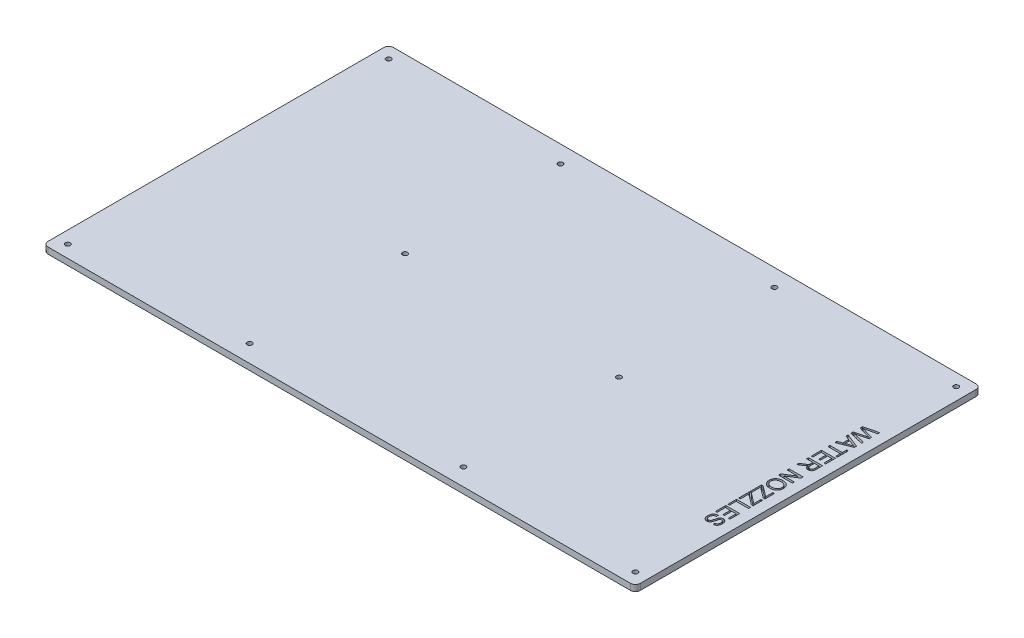
from build123d import *

# Parameters (mm, degrees)
SKETCH1_W           = 304.8
SKETCH1_H           = 177.8
SKETCH1_R           = 1.27
BOSS_EXTRUDE1_DEPTH = 3.175
CUT_EXTRUDE1_DEPTH  = 2.54
FILLET1_R           = 2.54


with BuildPart() as part:
    # Sketch1 → Boss-Extrude1 (new body)
    with BuildSketch(Plane(origin=(0, 0, 0), x_dir=(1, 0, 0), z_dir=(0, 1, 0))):
        Rectangle(SKETCH1_W, SKETCH1_H)
        with Locations((-55.0291, 80.01)):
            Circle(SKETCH1_R, mode=Mode.SUBTRACT)
        with Locations((-55.033333333, 0)):
            Circle(SKETCH1_R, mode=Mode.SUBTRACT)
        with Locations((-55.0291, -80.01)):
            Circle(SKETCH1_R, mode=Mode.SUBTRACT)
        with Locations((55.0291, -80.01)):
            Circle(SKETCH1_R, mode=Mode.SUBTRACT)
        with Locations((55.033333333, 0)):
            Circle(SKETCH1_R, mode=Mode.SUBTRACT)
        with Locations((55.0291, 80.01)):
            Circle(SKETCH1_R, mode=Mode.SUBTRACT)
        with Locations((-146.05, 82.55)):
            Circle(SKETCH1_R, mode=Mode.SUBTRACT)
        with Locations((-146.05, -82.55)):
            Circle(SKETCH1_R, mode=Mode.SUBTRACT)
        with Locations((146.05, -82.55)):
            Circle(SKETCH1_R, mode=Mode.SUBTRACT)
        with Locations((146.05, 82.55)):
            Circle(SKETCH1_R, mode=Mode.SUBTRACT)
    extrude(amount=BOSS_EXTRUDE1_DEPTH)

    # Sketch2 → Cut-Extrude1 (cut)
    # profile 1 of 12: a face of its own
    with BuildSketch(Plane(origin=(0, 3.175, 0), x_dir=(1, 0, 0), z_dir=(0, 1, 0))):
        with BuildLine():
            Line((139.7, 40.599397314), (146.891292318, 42.410185463))
            Line((146.891292318, 42.410185463), (146.891292318, 41.362895897))
            Line((146.891292318, 41.362895897), (142.161922791, 40.295438444))
            add(Edge.make_bspline(
                [(142.161922791, 40.295438444), (141.918010101, 40.240116159), (141.43267487, 40.130036385), (140.947069932, 40.021152573), (140.705513229, 39.966989996)],
                knots=[0, 0, 0, 0, 1.00513078, 2, 2, 2, 2], degree=3))
            add(Edge.make_bspline(
                [(140.705513229, 39.966989996), (140.792371041, 39.941345716), (140.956342762, 39.892933987), (141.188788479, 39.827490711), (141.391660637, 39.768050681), (141.565904996, 39.717410826), (141.711766359, 39.676407931), (141.82745239, 39.641006497), (141.915228597, 39.616877322), (141.963619911, 39.602578329), (141.983292933, 39.596765212)],
                knots=[0, 0, 0, 0, 1.633809233, 3.084334118, 4.356383392, 5.447555203, 6.357852567, 7.089694452, 7.629924063, 8, 8, 8, 8], degree=3))
            Line((141.983292933, 39.596765212), (146.891292318, 38.176369734))
            Line((146.891292318, 38.176369734), (146.891292318, 36.956212564))
            Line((146.891292318, 36.956212564), (143.288443342, 35.929090885))
            add(Edge.make_bspline(
                [(143.288443342, 35.929090885), (143.065873463, 35.872408071), (142.627013829, 35.760641828), (141.973316149, 35.612142336), (141.335477306, 35.475082051), (140.913616359, 35.396132754), (140.705513229, 35.357187229)],
                knots=[0, 0, 0, 0, 1.04154457, 2.053700482, 3.039894486, 4, 4, 4, 4], degree=3))
            add(Edge.make_bspline(
                [(140.705513229, 35.357187229), (140.812108286, 35.333148364), (141.036323517, 35.282584298), (141.390339814, 35.203396852), (141.778206423, 35.11544733), (142.048588999, 35.054626897), (142.189293495, 35.022976528)],
                knots=[0, 0, 0, 0, 0.862132589, 1.813435466, 2.862132822, 4, 4, 4, 4], degree=3))
            Line((142.189293495, 35.022976528), (146.891292318, 33.961281328))
            Line((146.891292318, 33.961281328), (146.891292318, 32.913991762))
            Line((146.891292318, 32.913991762), (139.7, 34.726220475))
            Line((139.7, 34.726220475), (139.7, 35.841216519))
            Line((139.7, 35.841216519), (145.195749237, 37.343724109))
            add(Edge.make_bspline(
                [(145.195749237, 37.343724109), (145.249475294, 37.35881145), (145.351534795, 37.387471778), (145.497177163, 37.425038757), (145.625263633, 37.462292796), (145.737449513, 37.491924711), (145.832604318, 37.517568652), (145.910449451, 37.540277459), (145.972508465, 37.554883152), (146.007780963, 37.565445312), (146.022632609, 37.569892557)],
                knots=[0, 0, 0, 0, 1.562239628, 2.967673567, 4.210417925, 5.296319877, 6.215971374, 6.969386481, 7.566055473, 8, 8, 8, 8], degree=3))
            add(Edge.make_bspline(
                [(146.022632609, 37.569892557), (145.928450634, 37.596558009), (145.750492988, 37.646942608), (145.499965869, 37.721559871), (145.2796766, 37.784171595), (145.143390879, 37.823850077), (145.080504168, 37.842159033)],
                knots=[0, 0, 0, 0, 1.197730334, 2.263121701, 3.198547257, 4, 4, 4, 4], degree=3))
            Line((145.080504168, 37.842159033), (139.7, 39.399408031))
            Line((139.7, 39.399408031), (139.7, 40.599397314))
        make_face()
    # profile 2 of 12: a face of its own
    with BuildSketch(Plane(origin=(0, 3.175, 0), x_dir=(1, 0, 0), z_dir=(0, 1, 0))):
        Polygon((139.7, 33.252524153), (146.891292318, 30.397327563), (146.891292318, 29.253520252), (139.7, 26.398323662), (139.7, 27.474424496), (141.912705329, 28.292664487), (141.912705329, 31.358183328), (139.7, 32.176423319), align=None)
        with BuildLine():
            Line((142.742469827, 31.052783894), (142.742469827, 28.598063921))
            Line((142.742469827, 28.598063921), (144.632488962, 29.296737152))
            add(Edge.make_bspline(
                [(144.632488962, 29.296737152), (144.705516725, 29.32352179), (144.848299792, 29.375890813), (145.055751534, 29.453988804), (145.252756224, 29.52533787), (145.436489095, 29.595301488), (145.609619053, 29.658458896), (145.770976683, 29.716672698), (145.919440472, 29.774245656), (146.015363377, 29.808795999), (146.06152782, 29.825423907)],
                knots=[0, 0, 0, 0, 1.225184869, 2.395467751, 3.491410812, 4.525364584, 5.492066482, 6.394148129, 7.227157926, 8, 8, 8, 8], degree=3))
            add(Edge.make_bspline(
                [(146.06152782, 29.825423907), (145.947690369, 29.852929678), (145.71954608, 29.908054634), (145.385284092, 30.02347287), (145.05407908, 30.155507323), (144.840652831, 30.262735032), (144.733328397, 30.316656015)],
                knots=[0, 0, 0, 0, 0.9891762, 1.982431084, 2.985436691, 4, 4, 4, 4], degree=3))
            Line((144.733328397, 30.316656015), (142.742469827, 31.052783894))
        make_face(mode=Mode.SUBTRACT)
    # profile 3 of 12: a face of its own
    with BuildSketch(Plane(origin=(0, 3.175, 0), x_dir=(1, 0, 0), z_dir=(0, 1, 0))):
        Polygon((139.7, 23.878778337), (146.06152782, 23.878778337), (146.06152782, 26.183679721), (146.891292318, 26.183679721), (146.891292318, 20.559720344), (146.06152782, 20.559720344), (146.06152782, 22.864621728), (139.7, 22.864621728), align=None)
    # profile 4 of 12: a face of its own
    with BuildSketch(Plane(origin=(0, 3.175, 0), x_dir=(1, 0, 0), z_dir=(0, 1, 0))):
        Polygon((139.7, 19.545563735), (146.891292318, 19.545563735), (146.891292318, 14.474780691), (146.06152782, 14.474780691), (146.06152782, 18.531407126), (143.848822491, 18.531407126), (143.848822491, 14.751368857), (143.019057993, 14.751368857), (143.019057993, 18.531407126), (140.529764498, 18.531407126), (140.529764498, 14.29038858), (139.7, 14.29038858), align=None)
    # profile 5 of 12: a face of its own
    with BuildSketch(Plane(origin=(0, 3.175, 0), x_dir=(1, 0, 0), z_dir=(0, 1, 0))):
        with BuildLine():
            Line((139.7, 12.90744775), (146.891292318, 12.90744775))
            Line((146.891292318, 12.90744775), (146.891292318, 9.787187501))
            add(Edge.make_bspline(
                [(146.891292318, 9.787187501), (146.890719358, 9.713714577), (146.88961046, 9.571516331), (146.881686545, 9.365305218), (146.864852182, 9.173282605), (146.846050259, 8.99423828), (146.818288848, 8.828478621), (146.785719716, 8.675924614), (146.747226755, 8.537161395), (146.70172659, 8.41113294), (146.65026646, 8.294196999), (146.586739284, 8.185835298), (146.517241888, 8.081403532), (146.434932223, 7.98503292), (146.346427046, 7.89250504), (146.247351056, 7.806981757), (146.139103449, 7.728045686), (145.984348252, 7.630645623), (145.777192572, 7.528158567), (145.513452672, 7.440686114), (145.236989629, 7.384760592), (145.048120631, 7.378739403), (144.952294029, 7.375684428)],
                knots=[0, 0, 0, 0, 1.242122331, 2.403982386, 3.487329914, 4.500326623, 5.446523787, 6.327028739, 7.136568587, 7.878666205, 8.590811102, 9.292609518, 9.999600102, 10.708452415, 11.431798422, 12.162621657, 12.917616336, 13.694634159, 15.252079616, 16.810286496, 18.381632726, 20, 20, 20, 20], degree=3))
            add(Edge.make_bspline(
                [(144.952294029, 7.375684428), (144.890778569, 7.37709165), (144.769281319, 7.379871008), (144.590647648, 7.401160869), (144.419971093, 7.439683966), (144.255753461, 7.48907958), (144.100333994, 7.556697048), (143.950491545, 7.63499364), (143.810516278, 7.732126935), (143.675747631, 7.84058847), (143.552200949, 7.966682451), (143.438215685, 8.107045246), (143.339735409, 8.265209511), (143.25123324, 8.438264749), (143.173787754, 8.626524977), (143.10867237, 8.83124209), (143.057693754, 9.051691208), (143.032157635, 9.204567236), (143.019057993, 9.282990324)],
                knots=[0, 0, 0, 0, 0.98268397, 1.940868231, 2.867803148, 3.77529712, 4.675825539, 5.571570676, 6.471608834, 7.392971743, 8.331421822, 9.286283743, 10.275919943, 11.301762849, 12.388744527, 13.524158817, 14.729930953, 16, 16, 16, 16], degree=3))
            add(Edge.make_bspline(
                [(143.019057993, 9.282990324), (142.989925812, 9.2250232), (142.934789019, 9.115312181), (142.846271077, 8.963984742), (142.758672467, 8.834036947), (142.694617331, 8.759083356), (142.664679405, 8.724051738)],
                knots=[0, 0, 0, 0, 1.172410807, 2.218954047, 3.167579294, 4, 4, 4, 4], degree=3))
            add(Edge.make_bspline(
                [(142.664679405, 8.724051738), (142.598176784, 8.65600296), (142.46179086, 8.516446123), (142.2273313, 8.326002591), (141.969492889, 8.137560987), (141.78160129, 8.024424583), (141.685096317, 7.966315408)],
                knots=[0, 0, 0, 0, 0.918170575, 1.883016652, 2.912673989, 4, 4, 4, 4], degree=3))
            Line((141.685096317, 7.966315408), (139.7, 6.786494012))
            Line((139.7, 6.786494012), (139.7, 7.949028648))
            Line((139.7, 7.949028648), (141.218353787, 8.845059061))
            add(Edge.make_bspline(
                [(141.218353787, 8.845059061), (141.271626158, 8.877277139), (141.374859267, 8.939710486), (141.525640959, 9.0298715), (141.664406238, 9.11835134), (141.795360764, 9.200146835), (141.915099613, 9.2796333), (142.027194869, 9.352347094), (142.127215347, 9.423882684), (142.247678565, 9.507079512), (142.378793463, 9.607385335), (142.51264314, 9.725227599), (142.621935013, 9.834572419), (142.727516561, 9.971377692), (142.8258971, 10.141134426), (142.871617982, 10.285131355), (142.89372898, 10.354769467)],
                knots=[0, 0, 0, 0, 1.130769053, 2.191244754, 3.190605808, 4.119719489, 4.995392299, 5.800890497, 6.546104885, 7.228445539, 8.4599972, 9.541354885, 10.466489475, 11.262010607, 12.675885558, 14, 14, 14, 14], degree=3))
            add(Edge.make_bspline(
                [(142.89372898, 10.354769467), (142.899000238, 10.383999999), (142.911034679, 10.450734181), (142.918894392, 10.564048654), (142.927236425, 10.701343041), (142.926993366, 10.800842622), (142.926861937, 10.854644955)],
                knots=[0, 0, 0, 0, 0.709978628, 1.620902492, 2.713552433, 4, 4, 4, 4], degree=3))
            Line((142.926861937, 10.854644955), (142.926861937, 11.893291141))
            Line((142.926861937, 11.893291141), (139.7, 11.893291141))
            Line((139.7, 11.893291141), (139.7, 12.90744775))
        make_face()
        with BuildLine():
            Line((143.756626436, 11.893291141), (143.756626436, 9.967257922))
            add(Edge.make_bspline(
                [(143.756626436, 9.967257922), (143.758143556, 9.870680588), (143.76097967, 9.690138321), (143.785027209, 9.437659887), (143.823660549, 9.222100977), (143.879107351, 9.039438161), (143.956434937, 8.886057448), (144.052511636, 8.754288984), (144.169411157, 8.642191056), (144.303830251, 8.550576168), (144.450495496, 8.478417995), (144.605647263, 8.429158458), (144.765929244, 8.394839629), (144.875280389, 8.391521992), (144.930685578, 8.389841037)],
                knots=[0, 0, 0, 0, 1.545806995, 2.889741191, 4.055176196, 5.047087691, 5.934047151, 6.79198357, 7.645535072, 8.5133672, 9.386595861, 10.252007348, 11.114340652, 12, 12, 12, 12], degree=3))
            add(Edge.make_bspline(
                [(144.930685578, 8.389841037), (144.971051349, 8.391179534), (145.050116036, 8.393801256), (145.166161046, 8.407545188), (145.276430627, 8.434266655), (145.381507679, 8.469552288), (145.480622586, 8.516701053), (145.574543379, 8.572711862), (145.662749512, 8.639550049), (145.745509673, 8.716109346), (145.820813333, 8.804013332), (145.885784057, 8.90442035), (145.940995157, 9.016538495), (145.984814377, 9.140498087), (146.01986262, 9.27590863), (146.043179085, 9.423540987), (146.060050802, 9.582720003), (146.061026282, 9.69302183), (146.06152782, 9.749732854)],
                knots=[0, 0, 0, 0, 0.965208469, 1.890559848, 2.786986821, 3.67262109, 4.535197034, 5.405224191, 6.282113641, 7.175449223, 8.095446547, 9.040936516, 10.026471658, 11.075712529, 12.17809725, 13.364958037, 14.645208957, 16, 16, 16, 16], degree=3))
            Line((146.06152782, 9.749732854), (146.06152782, 11.893291141))
            Line((146.06152782, 11.893291141), (143.756626436, 11.893291141))
        make_face(mode=Mode.SUBTRACT)
    # profile 6 of 12: a face of its own
    with BuildSketch(Plane(origin=(0, 3.175, 0), x_dir=(1, 0, 0), z_dir=(0, 1, 0))):
        Polygon((139.7, 2.950273771), (146.891292318, 2.950273771), (146.891292318, 1.878494628), (141.525193783, -1.567332941), (146.891292318, -1.567332941), (146.891292318, -2.58148955), (139.7, -2.58148955), (139.7, -1.509710406), (145.066098534, 1.936117162), (139.7, 1.936117162), align=None)
    # profile 7 of 12: a face of its own
    with BuildSketch(Plane(origin=(0, 3.175, 0), x_dir=(1, 0, 0), z_dir=(0, 1, 0))):
        with BuildLine():
            add(Edge.make_bspline(
                [(143.200568977, -3.872234325), (143.344742891, -3.874750601), (143.625658451, -3.879653438), (144.034795943, -3.92492341), (144.419281361, -3.999605887), (144.780893264, -4.102339363), (145.116904413, -4.238978276), (145.431446648, -4.401107285), (145.719045321, -4.597822571), (145.983025744, -4.820098076), (146.216382386, -5.068437708), (146.42364216, -5.332831608), (146.59651991, -5.61660193), (146.739260307, -5.917121453), (146.848852157, -6.235668389), (146.925576448, -6.57134797), (146.975071065, -6.923801293), (146.98064185, -7.164711385), (146.983488373, -7.287810063)],
                knots=[0, 0, 0, 0, 1.203593535, 2.345140965, 3.431924157, 4.471254512, 5.478692091, 6.45615896, 7.42038538, 8.382007041, 9.33218277, 10.260966195, 11.182476517, 12.100814648, 13.034113903, 13.98924309, 14.972556454, 16, 16, 16, 16], degree=3))
            add(Edge.make_bspline(
                [(146.983488373, -7.287810063), (146.982083246, -7.369004565), (146.979292919, -7.530242159), (146.957643942, -7.769046914), (146.920039242, -8.001421819), (146.86778006, -8.227532904), (146.801835233, -8.447603788), (146.721044891, -8.662083881), (146.623835099, -8.869598947), (146.513808435, -9.070695723), (146.389328101, -9.262238692), (146.254649039, -9.444049022), (146.106799681, -9.613148244), (145.947920566, -9.77054561), (145.777938945, -9.9165831), (145.594741796, -10.049441633), (145.401125111, -10.171807619), (145.195584993, -10.28104651), (144.982240572, -10.3788984), (144.760014789, -10.462484041), (144.531625728, -10.534270472), (144.295707331, -10.594358298), (144.052344136, -10.637473782), (143.802583707, -10.671806857), (143.545610036, -10.689877354), (143.372019731, -10.693107052), (143.284121652, -10.694742421)],
                knots=[0, 0, 0, 0, 1.034309052, 2.053950705, 3.051627699, 4.031038476, 5.008402854, 5.97643726, 6.948041091, 7.925482047, 8.894385902, 9.856059247, 10.805611944, 11.752954998, 12.703138077, 13.657545741, 14.63347317, 15.618750787, 16.620694897, 17.621667406, 18.641309059, 19.669521506, 20.720627516, 21.788266251, 22.880080611, 24, 24, 24, 24], degree=3))
            add(Edge.make_bspline(
                [(143.284121652, -10.694742421), (143.194774132, -10.693244066), (143.018252702, -10.690283806), (142.75747654, -10.670253479), (142.504186722, -10.635033201), (142.257627978, -10.588319503), (142.018313612, -10.525724559), (141.78555742, -10.451340137), (141.560746026, -10.361367792), (141.343336543, -10.259754686), (141.136322927, -10.144777048), (140.941138804, -10.017957762), (140.759660471, -9.879166874), (140.589476659, -9.7306586), (140.434565882, -9.56868993), (140.290383421, -9.3967376), (140.161526545, -9.211921943), (140.044348478, -9.017795627), (139.943626094, -8.815008266), (139.85320227, -8.608118694), (139.77713015, -8.396879802), (139.714892871, -8.181819365), (139.667370015, -7.96275636), (139.63270603, -7.740089103), (139.612261458, -7.512920576), (139.609297418, -7.360358764), (139.607803945, -7.283488373)],
                knots=[0, 0, 0, 0, 1.141388526, 2.255009839, 3.338557341, 4.406873761, 5.458773361, 6.496627797, 7.526383469, 8.5499449, 9.560445588, 10.548978906, 11.520676971, 12.476877461, 13.431305422, 14.380871584, 15.340724931, 16.306479833, 17.274880643, 18.230982746, 19.189541512, 20.140849708, 21.088988189, 22.051132196, 23.018035844, 24, 24, 24, 24], degree=3))
            add(Edge.make_bspline(
                [(139.607803945, -7.283488373), (139.609026868, -7.200837462), (139.611449174, -7.037126706), (139.635624736, -6.795157068), (139.672512416, -6.559210096), (139.725741713, -6.329958393), (139.795273652, -6.107764179), (139.878947671, -5.892589322), (139.977210681, -5.683912211), (140.091114191, -5.483159574), (140.216853762, -5.290518027), (140.356042488, -5.109892863), (140.505615144, -4.940767394), (140.667824314, -4.78521722), (140.839585734, -4.640794425), (141.022012391, -4.507224855), (141.216181233, -4.386540322), (141.421009429, -4.27937035), (141.631310907, -4.18273359), (141.84697264, -4.101270405), (142.064864534, -4.029692273), (142.286316752, -3.972684518), (142.51082187, -3.927257082), (142.738005404, -3.896710233), (142.968205951, -3.87464912), (143.122724858, -3.873043307), (143.200568977, -3.872234325)],
                knots=[0, 0, 0, 0, 1.072763531, 2.124875893, 3.153923666, 4.171672792, 5.177320289, 6.174136357, 7.166947757, 8.169130198, 9.168574722, 10.151174515, 11.127106349, 12.097106019, 13.066163601, 14.038804255, 15.030068075, 16.031241659, 17.038395341, 18.032966873, 19.022680693, 20.014630449, 21.000093848, 21.9946263, 22.989725266, 24, 24, 24, 24], degree=3))
        make_face()
        with BuildLine():
            add(Edge.make_bspline(
                [(143.18904447, -4.886390934), (143.085221971, -4.8879442), (142.882775424, -4.890972961), (142.587626766, -4.925655463), (142.309110467, -4.978218734), (142.04657521, -5.050883677), (141.801950955, -5.147900238), (141.574767951, -5.266514417), (141.363952405, -5.405651782), (141.171893417, -5.565239122), (140.999302669, -5.740590433), (140.848487893, -5.927974178), (140.722728679, -6.127216277), (140.6176871, -6.335678791), (140.536752949, -6.556125666), (140.479539754, -6.78750075), (140.443827808, -7.029799504), (140.439680892, -7.195008701), (140.437568443, -7.279166683)],
                knots=[0, 0, 0, 0, 1.215616022, 2.370365452, 3.475740397, 4.533490648, 5.5560781, 6.552384115, 7.530550651, 8.509299237, 9.471863928, 10.40830403, 11.321168121, 12.226759389, 13.137923578, 14.065605683, 15.014614662, 16, 16, 16, 16], degree=3))
            add(Edge.make_bspline(
                [(140.437568443, -7.279166683), (140.439710612, -7.364751904), (140.443904973, -7.532327525), (140.479014467, -7.778268523), (140.538786878, -8.011940024), (140.618357524, -8.235658031), (140.725923367, -8.445378297), (140.851882769, -8.646004235), (141.005800048, -8.832071834), (141.178701115, -9.008128732), (141.375212877, -9.166098945), (141.590597748, -9.306038803), (141.827532292, -9.420500369), (142.082609039, -9.515981831), (142.357428744, -9.590879144), (142.651988993, -9.643239378), (142.965513323, -9.675529508), (143.180800424, -9.678870576), (143.291324469, -9.680585812)],
                knots=[0, 0, 0, 0, 0.976909331, 1.912785716, 2.828990727, 3.727421029, 4.617481149, 5.514840137, 6.426786422, 7.368873452, 8.327895072, 9.299698503, 10.295216142, 11.325792517, 12.405818789, 13.542541501, 14.738390493, 16, 16, 16, 16], degree=3))
            add(Edge.make_bspline(
                [(143.291324469, -9.680585812), (143.362425152, -9.679973492), (143.501898963, -9.678772341), (143.70748495, -9.662865064), (143.906676055, -9.642346743), (144.099215164, -9.611107188), (144.284305234, -9.568055435), (144.46335426, -9.520360321), (144.634823252, -9.460723284), (144.799370302, -9.39304249), (144.956202525, -9.317360319), (145.103810699, -9.231814906), (145.242544392, -9.138069923), (145.372016781, -9.035938503), (145.492498367, -8.925780008), (145.603699761, -8.807282133), (145.706272053, -8.680155085), (145.799327504, -8.545135144), (145.883147711, -8.404352342), (145.954806581, -8.258012949), (146.018195963, -8.108144741), (146.065615012, -7.952681798), (146.10534388, -7.794141201), (146.134617552, -7.631591409), (146.149998026, -7.463860061), (146.152473006, -7.350742518), (146.153723875, -7.293572317)],
                knots=[0, 0, 0, 0, 1.220471707, 2.394123819, 3.538599016, 4.658184489, 5.740257119, 6.800339203, 7.838063059, 8.854709651, 9.853990799, 10.825506309, 11.781362566, 12.726491381, 13.654344845, 14.581758638, 15.513997413, 16.45624495, 17.395131889, 18.32430312, 19.252156584, 20.185670527, 21.111507116, 22.057642305, 23.018322208, 24, 24, 24, 24], degree=3))
            add(Edge.make_bspline(
                [(146.153723875, -7.293572317), (146.152077995, -7.21277849), (146.148820798, -7.052887511), (146.114128055, -6.81808813), (146.060877956, -6.5919658), (145.987756036, -6.374110973), (145.889798934, -6.165720828), (145.771818286, -5.965413326), (145.632145804, -5.774112058), (145.47246777, -5.591935999), (145.288171775, -5.422171447), (145.07105564, -5.278564966), (144.826119231, -5.157554337), (144.55403582, -5.056505561), (144.252683068, -4.979460811), (143.923362322, -4.926212708), (143.565725227, -4.892593093), (143.317814674, -4.888511173), (143.18904447, -4.886390934)],
                knots=[0, 0, 0, 0, 0.895069985, 1.771343461, 2.624796936, 3.468163849, 4.31361133, 5.172690577, 6.041527277, 6.935393444, 7.854933085, 8.810158187, 9.810009302, 10.877887247, 12.021813459, 13.252239476, 14.572752642, 16, 16, 16, 16], degree=3))
        make_face(mode=Mode.SUBTRACT)
    # profile 8 of 12: a face of its own
    with BuildSketch(Plane(origin=(0, 3.175, 0), x_dir=(1, 0, 0), z_dir=(0, 1, 0))):
        with BuildLine():
            Line((139.7, -11.340114809), (140.564338019, -11.340114809))
            Line((140.564338019, -11.340114809), (145.236085011, -14.88101956))
            add(Edge.make_bspline(
                [(145.236085011, -14.88101956), (145.314721794, -14.94119326), (145.465510402, -15.056578301), (145.683391248, -15.219549317), (145.87842203, -15.370205961), (146.002848792, -15.46361391), (146.06152782, -15.507664623)],
                knots=[0, 0, 0, 0, 1.146521337, 2.198492228, 3.150418105, 4, 4, 4, 4], degree=3))
            Line((146.06152782, -15.507664623), (146.06152782, -11.801095085))
            Line((146.06152782, -11.801095085), (146.891292318, -11.801095085))
            Line((146.891292318, -11.801095085), (146.891292318, -16.779682075))
            Line((146.891292318, -16.779682075), (146.06152782, -16.779682075))
            Line((146.06152782, -16.779682075), (140.992185338, -12.93769958))
            Line((140.992185338, -12.93769958), (140.529764498, -12.587642683))
            Line((140.529764498, -12.587642683), (140.529764498, -16.964074185))
            Line((140.529764498, -16.964074185), (139.7, -16.964074185))
            Line((139.7, -16.964074185), (139.7, -11.340114809))
        make_face()
    # profile 9 of 12: a face of its own
    with BuildSketch(Plane(origin=(0, 3.175, 0), x_dir=(1, 0, 0), z_dir=(0, 1, 0))):
        with BuildLine():
            Line((139.7, -17.425054462), (140.564338019, -17.425054462))
            Line((140.564338019, -17.425054462), (145.236085011, -20.965959213))
            add(Edge.make_bspline(
                [(145.236085011, -20.965959213), (145.314721794, -21.026132913), (145.465510402, -21.141517954), (145.683391248, -21.304488971), (145.87842203, -21.455145614), (146.002848792, -21.548553563), (146.06152782, -21.592604277)],
                knots=[0, 0, 0, 0, 1.146521337, 2.198492228, 3.150418105, 4, 4, 4, 4], degree=3))
            Line((146.06152782, -21.592604277), (146.06152782, -17.886034739))
            Line((146.06152782, -17.886034739), (146.891292318, -17.886034739))
            Line((146.891292318, -17.886034739), (146.891292318, -22.864621728))
            Line((146.891292318, -22.864621728), (146.06152782, -22.864621728))
            Line((146.06152782, -22.864621728), (140.992185338, -19.022639234))
            Line((140.992185338, -19.022639234), (140.529764498, -18.672582336))
            Line((140.529764498, -18.672582336), (140.529764498, -23.049013839))
            Line((140.529764498, -23.049013839), (139.7, -23.049013839))
            Line((139.7, -23.049013839), (139.7, -17.425054462))
        make_face()
    # profile 10 of 12: a face of its own
    with BuildSketch(Plane(origin=(0, 3.175, 0), x_dir=(1, 0, 0), z_dir=(0, 1, 0))):
        Polygon((139.7, -24.155366503), (146.891292318, -24.155366503), (146.891292318, -25.169523112), (140.529764498, -25.169523112), (140.529764498, -28.58077716), (139.7, -28.58077716), align=None)
    # profile 11 of 12: a face of its own
    with BuildSketch(Plane(origin=(0, 3.175, 0), x_dir=(1, 0, 0), z_dir=(0, 1, 0))):
        Polygon((139.7, -29.687129824), (146.891292318, -29.687129824), (146.891292318, -34.757912869), (146.06152782, -34.757912869), (146.06152782, -30.701286433), (143.848822491, -30.701286433), (143.848822491, -34.481324703), (143.019057993, -34.481324703), (143.019057993, -30.701286433), (140.529764498, -30.701286433), (140.529764498, -34.94230498), (139.7, -34.94230498), align=None)
    # profile 12 of 12: a face of its own
    with BuildSketch(Plane(origin=(0, 3.175, 0), x_dir=(1, 0, 0), z_dir=(0, 1, 0))):
        with BuildLine():
            Line((142.189293495, -35.956461589), (142.189293495, -36.970618197))
            add(Edge.make_bspline(
                [(142.189293495, -36.970618197), (142.098227577, -36.981757345), (141.923285047, -37.003156248), (141.675467459, -37.063286959), (141.451963587, -37.139758907), (141.252486254, -37.238292352), (141.074677214, -37.362432817), (140.916258038, -37.515197516), (140.777816883, -37.700138648), (140.656535096, -37.909646089), (140.559052, -38.141549993), (140.488167215, -38.389514826), (140.445784262, -38.652224335), (140.440345542, -38.832149429), (140.437568443, -38.92402212)],
                knots=[0, 0, 0, 0, 1.125661535, 2.162456423, 3.124646671, 4.021152204, 4.884793578, 5.777140414, 6.711097021, 7.712275503, 8.742730725, 9.791526725, 10.872317486, 12, 12, 12, 12], degree=3))
            add(Edge.make_bspline(
                [(140.437568443, -38.92402212), (140.439031704, -39.005324382), (140.44187622, -39.163372363), (140.477596268, -39.392598366), (140.527064736, -39.608441268), (140.602381616, -39.806959012), (140.695683221, -39.985963316), (140.80465797, -40.143354697), (140.932051158, -40.275186614), (141.073239919, -40.381340298), (141.223020959, -40.463802138), (141.377580062, -40.521272708), (141.533862437, -40.559970312), (141.639737395, -40.564176293), (141.692299134, -40.566264356)],
                knots=[0, 0, 0, 0, 1.267278989, 2.463534024, 3.612003651, 4.716903637, 5.765847919, 6.755281273, 7.693132489, 8.613187884, 9.50174055, 10.350585091, 11.181146174, 12, 12, 12, 12], degree=3))
            add(Edge.make_bspline(
                [(141.692299134, -40.566264356), (141.744337033, -40.564042154), (141.846149516, -40.559694401), (141.993229654, -40.525872371), (142.129589529, -40.469897461), (142.257456647, -40.392906632), (142.375516476, -40.287016906), (142.482170153, -40.151797624), (142.581694742, -39.987880384), (142.634997726, -39.864993089), (142.663238842, -39.799884646)],
                knots=[0, 0, 0, 0, 0.942390321, 1.843792698, 2.718029279, 3.604523015, 4.535311134, 5.574971969, 6.71516581, 8, 8, 8, 8], degree=3))
            add(Edge.make_bspline(
                [(142.663238842, -39.799884646), (142.673635955, -39.774549477), (142.697124923, -39.717312728), (142.728211504, -39.61920907), (142.768457767, -39.502809969), (142.809553502, -39.365687357), (142.854188881, -39.208036582), (142.902652909, -39.030219196), (142.956268911, -38.83246571), (143.012013971, -38.620457867), (143.069092289, -38.406013153), (143.126527692, -38.200751645), (143.183956445, -38.011604901), (143.240087198, -37.837555112), (143.296108725, -37.679613943), (143.350872692, -37.536970588), (143.403210454, -37.409429631), (143.441695304, -37.331532911), (143.459870382, -37.294744955)],
                knots=[0, 0, 0, 0, 0.499203687, 1.127791816, 1.87544445, 2.745218927, 3.737540508, 4.863437871, 6.106074846, 7.473929386, 8.860961239, 10.152791525, 11.360569269, 12.465464948, 13.48744072, 14.416013254, 15.251937243, 16, 16, 16, 16], degree=3))
            add(Edge.make_bspline(
                [(143.459870382, -37.294744955), (143.505623048, -37.210133689), (143.593937601, -37.046811926), (143.751163746, -36.826838811), (143.927308225, -36.643060923), (144.118845767, -36.492938182), (144.325275365, -36.37607482), (144.544730043, -36.294560307), (144.77540831, -36.24082041), (144.933741398, -36.235668829), (145.014238253, -36.233049755)],
                knots=[0, 0, 0, 0, 1.158753891, 2.236696577, 3.247844099, 4.216965963, 5.160353944, 6.094570301, 7.031275781, 8, 8, 8, 8], degree=3))
            add(Edge.make_bspline(
                [(145.014238253, -36.233049755), (145.103396921, -36.236463302), (145.280732865, -36.243252823), (145.540872551, -36.303775552), (145.791775547, -36.399659187), (145.989827633, -36.51112498), (146.140452636, -36.617968569), (146.24876493, -36.706588875), (146.348298702, -36.806008261), (146.442474176, -36.911877453), (146.52761287, -37.028786695), (146.606678461, -37.15309709), (146.67752327, -37.287393179), (146.76389859, -37.477525303), (146.852455254, -37.730417697), (146.929180236, -38.048830276), (146.974094122, -38.383972532), (146.980312663, -38.61272555), (146.983488373, -38.729546066)],
                knots=[0, 0, 0, 0, 1.2001067, 2.387003517, 3.579163215, 4.810460134, 5.437089112, 6.066784591, 6.693680817, 7.331043701, 7.974292474, 8.640345033, 9.314862782, 10.018578828, 11.453312207, 12.917685044, 14.425910937, 16, 16, 16, 16], degree=3))
            add(Edge.make_bspline(
                [(146.983488373, -38.729546066), (146.98060003, -38.857420886), (146.974986626, -39.105941625), (146.927025725, -39.46762655), (146.846144952, -39.805204568), (146.754621517, -40.070252392), (146.662266515, -40.265896705), (146.590187472, -40.404884772), (146.506855035, -40.533893545), (146.416676094, -40.654085404), (146.319689217, -40.766569316), (146.21360136, -40.868482392), (146.101979476, -40.964143518), (145.942128649, -41.07682639), (145.72893327, -41.195650126), (145.455713009, -41.303923255), (145.16477571, -41.372481181), (144.964647565, -41.388096175), (144.8629791, -41.396028855)],
                knots=[0, 0, 0, 0, 1.607767564, 3.124646298, 4.577694013, 5.968230118, 6.64098443, 7.297468537, 7.935727887, 8.569831019, 9.186231226, 9.801209789, 10.418260488, 11.033239051, 12.257996117, 13.47812891, 14.718847046, 16, 16, 16, 16], degree=3))
            Line((144.8629791, -41.396028855), (144.8629791, -40.381872246))
            add(Edge.make_bspline(
                [(144.8629791, -40.381872246), (144.914525152, -40.375640591), (145.015489235, -40.363434548), (145.160585877, -40.329181339), (145.296895335, -40.288245811), (145.422777496, -40.236062187), (145.539379887, -40.174418579), (145.644406276, -40.099743281), (145.741911683, -40.017896579), (145.829209147, -39.924784264), (145.905892271, -39.820234025), (145.972322456, -39.704170215), (146.028477465, -39.576629878), (146.074459997, -39.437659639), (146.110115899, -39.287250812), (146.136344264, -39.125055841), (146.149777166, -38.951139003), (146.152385133, -38.831365119), (146.153723875, -38.76988184)],
                knots=[0, 0, 0, 0, 1.074597235, 2.104830896, 3.08320792, 4.01963776, 4.922947153, 5.808618242, 6.683501764, 7.556007728, 8.44518997, 9.363001905, 10.32032511, 11.326760392, 12.390579697, 13.518793479, 14.726327422, 16, 16, 16, 16], degree=3))
            add(Edge.make_bspline(
                [(146.153723875, -38.76988184), (146.153242696, -38.705972623), (146.152311252, -38.582260096), (146.135305996, -38.403423248), (146.112008952, -38.237651492), (146.077524005, -38.085287793), (146.032908805, -37.947055563), (145.980175443, -37.821112723), (145.914664236, -37.710081222), (145.841349306, -37.611308695), (145.759438373, -37.526611248), (145.675510216, -37.451159024), (145.585990201, -37.388913723), (145.493846569, -37.335456359), (145.395126212, -37.29776974), (145.294119688, -37.268273821), (145.188699933, -37.250319392), (145.117067801, -37.248258379), (145.080504168, -37.247206364)],
                knots=[0, 0, 0, 0, 1.464643987, 2.835190547, 4.115048982, 5.300866033, 6.411522794, 7.442255218, 8.424145068, 9.359957701, 10.255529779, 11.121374133, 11.943044406, 12.751479056, 13.556984722, 14.358492815, 15.162115312, 16, 16, 16, 16], degree=3))
            add(Edge.make_bspline(
                [(145.080504168, -37.247206364), (145.01863345, -37.249827183), (144.898548091, -37.254913952), (144.727942994, -37.306857298), (144.572425394, -37.386746529), (144.487809062, -37.46545015), (144.445215724, -37.505067206)],
                knots=[0, 0, 0, 0, 1.050964922, 2.039826012, 3.013306874, 4, 4, 4, 4], degree=3))
            add(Edge.make_bspline(
                [(144.445215724, -37.505067206), (144.423929608, -37.530041374), (144.376856676, -37.585270206), (144.314561257, -37.688031986), (144.251619181, -37.815441223), (144.189052223, -37.968349964), (144.12608776, -38.14649181), (144.061306532, -38.349594379), (143.996627982, -38.57881285), (143.935337661, -38.8265667), (143.872301749, -39.07647453), (143.810549238, -39.313746016), (143.751698246, -39.531962053), (143.694350717, -39.73039605), (143.638603387, -39.90923685), (143.583303603, -40.067866774), (143.532441227, -40.207568312), (143.496655487, -40.29315203), (143.48003827, -40.332893091)],
                knots=[0, 0, 0, 0, 0.523891657, 1.158554055, 1.913784378, 2.794767528, 3.797522645, 4.933640231, 6.202082727, 7.603978424, 9.013314845, 10.322177672, 11.523239011, 12.626145434, 13.623952425, 14.517289202, 15.3114987, 16, 16, 16, 16], degree=3))
            add(Edge.make_bspline(
                [(143.48003827, -40.332893091), (143.456200665, -40.384599637), (143.409411443, -40.486090922), (143.329494727, -40.629843092), (143.246621594, -40.764069125), (143.157821733, -40.887574131), (143.064922594, -41.001079951), (142.966861321, -41.103895701), (142.863327992, -41.195385156), (142.721289412, -41.303908777), (142.529500697, -41.415181345), (142.281657836, -41.510802434), (142.016850315, -41.570611546), (141.834272362, -41.577110695), (141.741278288, -41.580420965)],
                knots=[0, 0, 0, 0, 0.899337291, 1.765248388, 2.59684015, 3.3906421, 4.166844185, 4.912752363, 5.632941945, 6.347675468, 7.734877245, 9.118505574, 10.532342477, 12, 12, 12, 12], degree=3))
            add(Edge.make_bspline(
                [(141.741278288, -41.580420965), (141.647294493, -41.576667966), (141.460705423, -41.569217015), (141.185664504, -41.505061641), (140.919151389, -41.40427694), (140.707658551, -41.286081915), (140.546108758, -41.174351891), (140.42999415, -41.0804934), (140.322628501, -40.97640973), (140.220648249, -40.864663316), (140.126134124, -40.744386551), (140.039053943, -40.614565427), (139.958501207, -40.476570146), (139.860342982, -40.279516355), (139.757660158, -40.017796183), (139.67214938, -39.684417226), (139.616676423, -39.333076184), (139.610802309, -39.091823738), (139.607803945, -38.968679585)],
                knots=[0, 0, 0, 0, 1.197055466, 2.376552968, 3.581957237, 4.820753935, 5.454298064, 6.085440993, 6.72202542, 7.359198513, 8.013298489, 8.67051481, 9.351020706, 10.049282741, 11.476266879, 12.925760103, 14.430794493, 16, 16, 16, 16], degree=3))
            add(Edge.make_bspline(
                [(139.607803945, -38.968679585), (139.608469982, -38.890383529), (139.609778732, -38.736533456), (139.624868277, -38.511145505), (139.647360417, -38.29520848), (139.680173845, -38.089285872), (139.723876534, -37.892797237), (139.775031989, -37.70596567), (139.835883639, -37.528807978), (139.905943012, -37.361413528), (139.987910607, -37.20389291), (140.076102737, -37.053550828), (140.176873201, -36.913171473), (140.285662361, -36.780849601), (140.404624909, -36.657512962), (140.53315623, -36.54391707), (140.670523665, -36.438070055), (140.817054123, -36.341999298), (140.971012045, -36.256207986), (141.129762457, -36.179048126), (141.294470338, -36.114042164), (141.464299684, -36.061652945), (141.638114956, -36.017276792), (141.81736608, -35.986502916), (142.001490342, -35.963876938), (142.12632268, -35.958947972), (142.189293495, -35.956461589)],
                knots=[0, 0, 0, 0, 1.259794174, 2.475468585, 3.633483936, 4.752716887, 5.828920721, 6.87130154, 7.868357378, 8.841438305, 9.788394823, 10.72402761, 11.64389108, 12.56602382, 13.478685853, 14.398289622, 15.324106125, 16.267144882, 17.215109807, 18.158654996, 19.105737623, 20.061356657, 21.017194371, 21.990367343, 22.986254633, 24, 24, 24, 24], degree=3))
        make_face()
    extrude(amount=-CUT_EXTRUDE1_DEPTH, mode=Mode.SUBTRACT)

    # Fillet1
    fillet1_edges = [part.edges().sort_by_distance(p)[0] for p in [
        (152.4, 1.5875, -88.9),
        (152.4, 1.5875, 88.9),
        (-152.4, 1.5875, 88.9),
        (-152.4, 1.5875, -88.9),
    ]]
    fillet(fillet1_edges, radius=FILLET1_R)


solid = part.part
